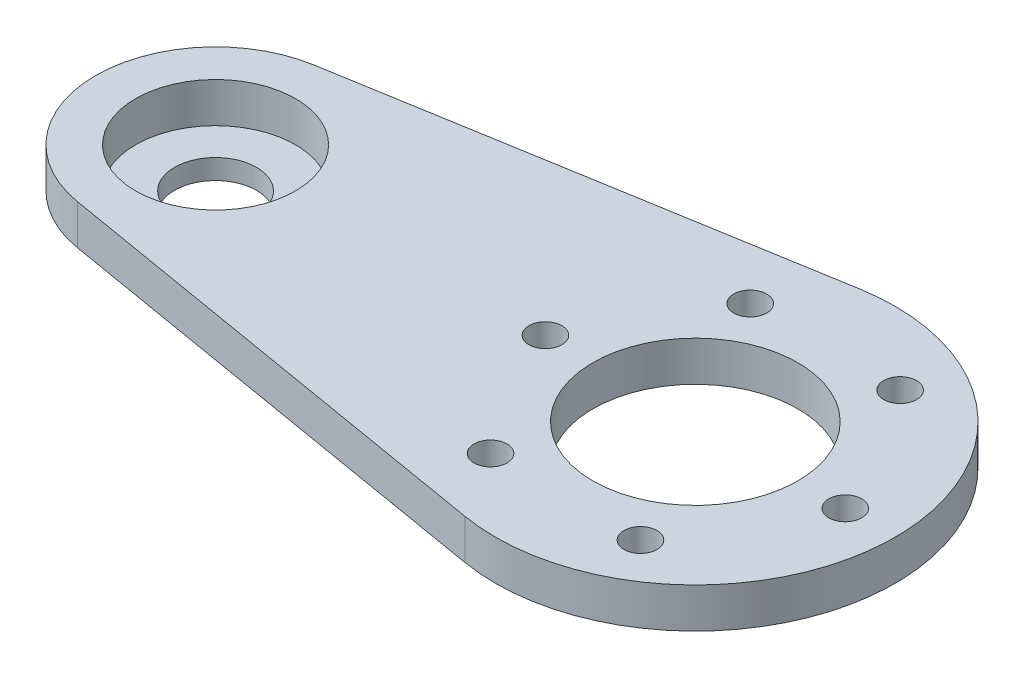
from build123d import *

# Parameters (mm, degrees)
SKETCH1_R           = 8
SKETCH1_R_2         = 1.65
SKETCH1_R_3         = 10.25
BOSS_EXTRUDE1_DEPTH = 4
SKETCH4_R           = 8
SKETCH4_R_2         = 4.15
BOSS_EXTRUDE3_DEPTH = 2
SKETCH5_R           = 10
SKETCH5_R_2         = 4.1
BOSS_EXTRUDE4_DEPTH = 2
FILLET6_R           = 2


with BuildPart() as part:
    # Sketch1 → Boss-Extrude1 (new body)
    with BuildSketch(Plane(origin=(0, 0, 0), x_dir=(1, 0, 0), z_dir=(0, 1, 0))):
        with BuildLine():
            Line((-3.333333333, 19.720265944), (-50, 11.832159566))
            ThreePointArc((-50, 11.832159566), (-60, 0), (-50, -11.832159566))
            Line((-50, -11.832159566), (-3.333333333, -19.720265944))
            ThreePointArc((-3.333333333, -19.720265944), (20, 0), (-3.333333333, 19.720265944))
        make_face()
        with Locations(Location((-48, 0, 0), (0, 0, 270))):
            Circle(SKETCH1_R, mode=Mode.SUBTRACT)
        with Locations(Location((-7.5, -12.990381057, 0), (0, 0, 270))):
            Circle(SKETCH1_R_2, mode=Mode.SUBTRACT)
        with Locations(Location((7.5, -12.990381057, 0), (0, 0, 270))):
            Circle(SKETCH1_R_2, mode=Mode.SUBTRACT)
        with Locations(Location((15, 0, 0), (0, 0, 270))):
            Circle(SKETCH1_R_2, mode=Mode.SUBTRACT)
        with BuildLine():
            ThreePointArc((-13.35, 0), (-15, -1.65), (-16.65, 0))
            ThreePointArc((-16.65, 0), (-15, 1.65), (-13.35, 0))
        make_face(mode=Mode.SUBTRACT)
        with Locations(Location((0, 0, 0), (0, 0, 270))):
            Circle(SKETCH1_R_3, mode=Mode.SUBTRACT)
        with Locations(Location((-7.5, 12.990381057, 0), (0, 0, 270))):
            Circle(SKETCH1_R_2, mode=Mode.SUBTRACT)
        with Locations(Location((7.5, 12.990381057, 0), (0, 0, 270))):
            Circle(SKETCH1_R_2, mode=Mode.SUBTRACT)
    extrude(amount=BOSS_EXTRUDE1_DEPTH)



with BuildPart() as body_2:
    # Sketch4 → Boss-Extrude3 (new body)
    with BuildSketch(Plane.XZ):
        with Locations(Location((-48, 0, 0), (0, 0, 90))):
            Circle(SKETCH4_R)
        with Locations(Location((-48, 0, 0), (0, 0, 270))):
            Circle(SKETCH4_R_2, mode=Mode.SUBTRACT)
    extrude(amount=BOSS_EXTRUDE3_DEPTH)


with BuildPart() as part_1:
    add(part.part)

    add(body_2.part)  # Boss-Extrude4 merges body 2
    # Sketch5 → Boss-Extrude4 (add)
    with BuildSketch(Plane.XZ):
        with Locations(Location((-48, 0, 0), (0, 0, 90))):
            Circle(SKETCH5_R)
        with Locations(Location((-48, 0, 0), (0, 0, 270))):
            Circle(SKETCH5_R_2, mode=Mode.SUBTRACT)
    extrude(amount=BOSS_EXTRUDE4_DEPTH)

    # Fillet6
    fillet6_edges = [part_1.edges().sort_by_distance(p)[0] for p in [
        (-48, 0, -10),
    ]]
    fillet(fillet6_edges, radius=FILLET6_R - 0.0001)  # a hair under: the kernel refuses the full size


solid = part_1.part
